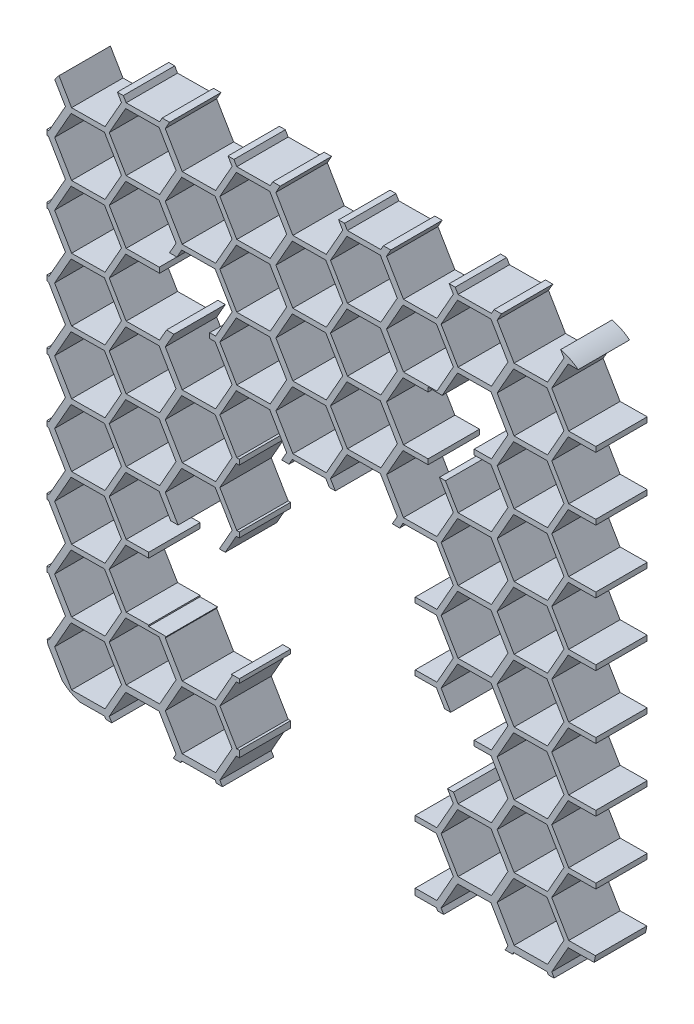
from build123d import *

# Parameters (mm, degrees)
BOSS_EXTRUDE1_DEPTH = 10
CUT_EXTRUDE3_REACH  = 78.178
SKETCH6_W           = 9.812922969
SKETCH6_H           = 13.289469161
SKETCH6_W_2         = 8.963334149
SKETCH6_H_2         = 14.059615098


with BuildPart() as part:
    # Sketch5 → Boss-Extrude1 (new body)
    with BuildSketch(Plane.XY):
        with BuildLine():
            Line((48.024312929, 39.190711098), (53.4, 39.238155691))
            Line((53.4, 39.238155691), (53.4, 40.238948483))
            Line((53.4, 40.238948483), (48.123676395, 40.192380849))
            Line((48.123676395, 40.192380849), (44.823994662, 45.792862211))
            Line((44.823994662, 45.792862211), (48.024312929, 51.450711098))
            Line((48.024312929, 51.450711098), (49.971786332, 51.467899056))
            ThreePointArc((49.971786332, 51.467899056), (48.354295075, 52.484772753), (46.558601308, 53.137301665))
            Line((46.558601308, 53.137301665), (47.206523211, 52.037597259))
            Line((47.206523211, 52.037597259), (44.006204944, 46.379748373))
            Line((44.006204944, 46.379748373), (37.506204944, 46.322380849))
            Line((37.506204944, 46.322380849), (34.206523211, 51.922862211))
            Line((34.206523211, 51.922862211), (35.042054725, 53.4))
            Line((35.042054725, 53.4), (33.607240311, 53.4))
            Line((33.607240311, 53.4), (33.103676395, 52.509748373))
            Line((33.103676395, 52.509748373), (26.603676395, 52.452380849))
            Line((26.603676395, 52.452380849), (26.045359814, 53.4))
            Line((26.045359814, 53.4), (24.883825167, 53.4))
            Line((24.883825167, 53.4), (25.686523211, 52.037597259))
            Line((25.686523211, 52.037597259), (22.486204944, 46.379748373))
            Line((22.486204944, 46.379748373), (15.986204944, 46.322380849))
            Line((15.986204944, 46.322380849), (12.686523211, 51.922862211))
            Line((12.686523211, 51.922862211), (13.522054726, 53.4))
            Line((13.522054726, 53.4), (12.087240312, 53.4))
            Line((12.087240312, 53.4), (11.583676395, 52.509748373))
            Line((11.583676395, 52.509748373), (5.083676395, 52.452380849))
            Line((5.083676395, 52.452380849), (4.525359815, 53.4))
            Line((4.525359815, 53.4), (3.363825167, 53.4))
            Line((3.363825167, 53.4), (4.166523212, 52.037597259))
            Line((4.166523212, 52.037597259), (0.966204945, 46.379748373))
            Line((0.966204945, 46.379748373), (-5.533795055, 46.322380849))
            Line((-5.533795055, 46.322380849), (-8.833476788, 51.922862211))
            Line((-8.833476788, 51.922862211), (-7.997945274, 53.4))
            Line((-7.997945274, 53.4), (-9.432759688, 53.4))
            Line((-9.432759688, 53.4), (-9.936323605, 52.509748373))
            Line((-9.936323605, 52.509748373), (-16.436323605, 52.452380849))
            Line((-16.436323605, 52.452380849), (-16.994640185, 53.4))
            Line((-16.994640185, 53.4), (-18.156174833, 53.4))
            Line((-18.156174833, 53.4), (-17.353476788, 52.037597259))
            Line((-17.353476788, 52.037597259), (-20.553795055, 46.379748373))
            Line((-20.553795055, 46.379748373), (-27.053795055, 46.322380849))
            Line((-27.053795055, 46.322380849), (-30.353476788, 51.922862211))
            Line((-30.353476788, 51.922862211), (-29.517945274, 53.4))
            Line((-29.517945274, 53.4), (-30.952759688, 53.4))
            Line((-30.952759688, 53.4), (-31.456323605, 52.509748373))
            Line((-31.456323605, 52.509748373), (-37.956323605, 52.452380849))
            Line((-37.956323605, 52.452380849), (-38.514640185, 53.4))
            Line((-38.514640185, 53.4), (-39.676174832, 53.4))
            Line((-39.676174832, 53.4), (-38.873476788, 52.037597259))
            Line((-38.873476788, 52.037597259), (-42.073795055, 46.379748373))
            Line((-42.073795055, 46.379748373), (-48.573795055, 46.322380849))
            Line((-48.573795055, 46.322380849), (-51.028226224, 50.488235962))
            ThreePointArc((-51.028226224, 50.488235962), (-51.462039029, 49.979211839), (-51.856853764, 49.439378131))
            Line((-51.856853764, 49.439378131), (-49.776005337, 45.907597259))
            Line((-49.776005337, 45.907597259), (-52.976323604, 40.249748373))
            Line((-52.976323604, 40.249748373), (-53.4, 40.246009101))
            Line((-53.4, 40.246009101), (-53.4, 39.24521631))
            Line((-53.4, 39.24521631), (-53.07568707, 39.248078622))
            Line((-53.07568707, 39.248078622), (-49.776005337, 33.647597259))
            Line((-49.776005337, 33.647597259), (-52.976323604, 27.989748373))
            Line((-52.976323604, 27.989748373), (-53.4, 27.986009101))
            Line((-53.4, 27.986009101), (-53.4, 26.98521631))
            Line((-53.4, 26.98521631), (-53.07568707, 26.988078622))
            Line((-53.07568707, 26.988078622), (-49.776005337, 21.387597259))
            Line((-49.776005337, 21.387597259), (-52.976323604, 15.729748373))
            Line((-52.976323604, 15.729748373), (-53.4, 15.726009101))
            Line((-53.4, 15.726009101), (-53.4, 14.72521631))
            Line((-53.4, 14.72521631), (-53.07568707, 14.728078622))
            Line((-53.07568707, 14.728078622), (-49.776005337, 9.127597259))
            Line((-49.776005337, 9.127597259), (-52.976323604, 3.469748373))
            Line((-52.976323604, 3.469748373), (-53.4, 3.466009101))
            Line((-53.4, 3.466009101), (-53.4, 2.46521631))
            Line((-53.4, 2.46521631), (-53.07568707, 2.468078622))
            Line((-53.07568707, 2.468078622), (-49.776005337, -3.132402741))
            Line((-49.776005337, -3.132402741), (-52.976323604, -8.790251627))
            Line((-52.976323604, -8.790251627), (-53.4, -8.793990899))
            Line((-53.4, -8.793990899), (-53.4, -9.79478369))
            Line((-53.4, -9.79478369), (-53.07568707, -9.791921378))
            Line((-53.07568707, -9.791921378), (-49.776005337, -15.392402741))
            Line((-49.776005337, -15.392402741), (-52.976323604, -21.050251627))
            Line((-52.976323604, -21.050251627), (-53.4, -21.053990899))
            Line((-53.4, -21.053990899), (-53.4, -22.05478369))
            Line((-53.4, -22.05478369), (-53.07568707, -22.051921378))
            Line((-53.07568707, -22.051921378), (-49.776005337, -27.652402741))
            Line((-49.776005337, -27.652402741), (-52.976323604, -33.310251627))
            Line((-52.976323604, -33.310251627), (-53.4, -33.313990899))
            Line((-53.4, -33.313990899), (-53.4, -34.31478369))
            Line((-53.4, -34.31478369), (-53.07568707, -34.311921378))
            Line((-53.07568707, -34.311921378), (-49.776005337, -39.912402741))
            Line((-49.776005337, -39.912402741), (-52.976323604, -45.570251627))
            Line((-52.976323604, -45.570251627), (-53.323190943, -45.573313))
            ThreePointArc((-53.323190943, -45.573313), (-53.242654146, -46.075549953), (-53.13387237, -46.572434908))
            Line((-53.13387237, -46.572434908), (-53.07568707, -46.571921378))
            Line((-53.07568707, -46.571921378), (-50.40636612, -51.10250446))
            ThreePointArc((-50.40636612, -51.10250446), (-48.82537198, -52.236841381), (-47.037518323, -53.004853113))
            Line((-47.037518323, -53.004853113), (-42.173158521, -52.961921378))
            Line((-42.173158521, -52.961921378), (-41.915052131, -53.4))
            Line((-41.915052131, -53.4), (-40.753517484, -53.4))
            Line((-40.753517484, -53.4), (-41.256005338, -52.547137788))
            Line((-41.256005338, -52.547137788), (-38.055687071, -46.889288902))
            Line((-38.055687071, -46.889288902), (-31.555687071, -46.831921378))
            Line((-31.555687071, -46.831921378), (-28.256005338, -52.432402741))
            Line((-28.256005338, -52.432402741), (-28.80331921, -53.4))
            Line((-28.80331921, -53.4), (-27.368504796, -53.4))
            Line((-27.368504796, -53.4), (-27.153158521, -53.019288902))
            Line((-27.153158521, -53.019288902), (-20.653158521, -52.961921378))
            Line((-20.653158521, -52.961921378), (-20.395052131, -53.4))
            Line((-20.395052131, -53.4), (-19.233517484, -53.4))
            Line((-19.233517484, -53.4), (-19.736005338, -52.547137788))
            Line((-19.736005338, -52.547137788), (-16.535687071, -46.889288902))
            Line((-16.535687071, -46.889288902), (-10.035687071, -46.831921378))
            Line((-10.035687071, -46.831921378), (-6.736005338, -52.432402741))
            Line((-6.736005338, -52.432402741), (-7.28331921, -53.4))
            Line((-7.28331921, -53.4), (-5.848504796, -53.4))
            Line((-5.848504796, -53.4), (-5.633158521, -53.019288902))
            Line((-5.633158521, -53.019288902), (0.866841479, -52.961921378))
            Line((0.866841479, -52.961921378), (1.124947869, -53.4))
            Line((1.124947869, -53.4), (2.286482516, -53.4))
            Line((2.286482516, -53.4), (1.783994662, -52.547137788))
            Line((1.783994662, -52.547137788), (4.984312929, -46.889288902))
            Line((4.984312929, -46.889288902), (11.484312929, -46.831921378))
            Line((11.484312929, -46.831921378), (14.783994662, -52.432402741))
            Line((14.783994662, -52.432402741), (14.23668079, -53.4))
            Line((14.23668079, -53.4), (15.671495204, -53.4))
            Line((15.671495204, -53.4), (15.886841478, -53.019288902))
            Line((15.886841478, -53.019288902), (22.386841478, -52.961921378))
            Line((22.386841478, -52.961921378), (22.644947868, -53.4))
            Line((22.644947868, -53.4), (23.806482516, -53.4))
            Line((23.806482516, -53.4), (23.303994662, -52.547137788))
            Line((23.303994662, -52.547137788), (26.504312929, -46.889288902))
            Line((26.504312929, -46.889288902), (33.004312929, -46.831921378))
            Line((33.004312929, -46.831921378), (36.303994662, -52.432402741))
            Line((36.303994662, -52.432402741), (35.756680789, -53.4))
            Line((35.756680789, -53.4), (37.191495203, -53.4))
            Line((37.191495203, -53.4), (37.406841478, -53.019288902))
            Line((37.406841478, -53.019288902), (43.906841478, -52.961921378))
            Line((43.906841478, -52.961921378), (44.164947868, -53.4))
            Line((44.164947868, -53.4), (44.4, -53.4))
            ThreePointArc((44.4, -53.4), (44.850518956, -53.388716965), (45.299908308, -53.354896149))
            Line((45.299908308, -53.354896149), (44.823994662, -52.547137788))
            Line((44.823994662, -52.547137788), (48.024312929, -46.889288902))
            Line((48.024312929, -46.889288902), (53.061570316, -46.844831212))
            ThreePointArc((53.061570316, -46.844831212), (53.21447846, -46.217957502), (53.322078928, -45.581739231))
            Line((53.322078928, -45.581739231), (48.123676395, -45.627619151))
            Line((48.123676395, -45.627619151), (44.823994662, -40.027137788))
            Line((44.823994662, -40.027137788), (48.024312929, -34.369288902))
            Line((48.024312929, -34.369288902), (53.4, -34.321844309))
            Line((53.4, -34.321844309), (53.4, -33.321051517))
            Line((53.4, -33.321051517), (48.123676395, -33.367619151))
            Line((48.123676395, -33.367619151), (44.823994662, -27.767137788))
            Line((44.823994662, -27.767137788), (48.024312929, -22.109288902))
            Line((48.024312929, -22.109288902), (53.4, -22.061844309))
            Line((53.4, -22.061844309), (53.4, -21.061051517))
            Line((53.4, -21.061051517), (48.123676395, -21.107619151))
            Line((48.123676395, -21.107619151), (44.823994662, -15.507137788))
            Line((44.823994662, -15.507137788), (48.024312929, -9.849288902))
            Line((48.024312929, -9.849288902), (53.4, -9.801844309))
            Line((53.4, -9.801844309), (53.4, -8.801051517))
            Line((53.4, -8.801051517), (48.123676395, -8.847619151))
            Line((48.123676395, -8.847619151), (44.823994662, -3.247137788))
            Line((44.823994662, -3.247137788), (48.024312929, 2.410711098))
            Line((48.024312929, 2.410711098), (53.4, 2.458155691))
            Line((53.4, 2.458155691), (53.4, 3.458948483))
            Line((53.4, 3.458948483), (48.123676395, 3.412380849))
            Line((48.123676395, 3.412380849), (44.823994662, 9.012862212))
            Line((44.823994662, 9.012862212), (48.024312929, 14.670711098))
            Line((48.024312929, 14.670711098), (53.4, 14.718155691))
            Line((53.4, 14.718155691), (53.4, 15.718948483))
            Line((53.4, 15.718948483), (48.123676395, 15.672380849))
            Line((48.123676395, 15.672380849), (44.823994662, 21.272862212))
            Line((44.823994662, 21.272862212), (48.024312929, 26.930711098))
            Line((48.024312929, 26.930711098), (53.4, 26.978155691))
            Line((53.4, 26.978155691), (53.4, 27.978948483))
            Line((53.4, 27.978948483), (48.123676395, 27.932380849))
            Line((48.123676395, 27.932380849), (44.823994662, 33.532862212))
            Line((44.823994662, 33.532862212), (48.024312929, 39.190711098))
        make_face()
        Polygon((-42.173158521, -40.441921378), (-38.873476788, -46.042402741), (-42.073795055, -51.700251627), (-48.573795055, -51.757619151), (-51.873476788, -46.157137788), (-48.673158521, -40.499288902), align=None, mode=Mode.SUBTRACT)
        Polygon((-42.173158521, -28.181921378), (-38.873476788, -33.782402741), (-42.073795055, -39.440251627), (-48.573795055, -39.497619151), (-51.873476788, -33.897137788), (-48.673158521, -28.239288902), align=None, mode=Mode.SUBTRACT)
        Polygon((-31.555687071, -34.311921378), (-28.256005338, -39.912402741), (-31.456323605, -45.570251627), (-37.956323605, -45.627619151), (-41.256005338, -40.027137788), (-38.055687071, -34.369288902), align=None, mode=Mode.SUBTRACT)
        Polygon((-20.653158521, -40.441921378), (-17.353476788, -46.042402741), (-20.553795055, -51.700251627), (-27.053795055, -51.757619151), (-30.353476788, -46.157137788), (-27.153158521, -40.499288902), align=None, mode=Mode.SUBTRACT)
        Polygon((-20.653158521, -28.181921378), (-17.353476788, -33.782402741), (-20.553795055, -39.440251627), (-27.053795055, -39.497619151), (-30.353476788, -33.897137788), (-27.153158521, -28.239288902), align=None, mode=Mode.SUBTRACT)
        Polygon((-10.035687071, -34.311921378), (-6.736005338, -39.912402741), (-9.936323605, -45.570251627), (-16.436323605, -45.627619151), (-19.736005338, -40.027137788), (-16.535687071, -34.369288902), align=None, mode=Mode.SUBTRACT)
        Polygon((-42.173158521, -15.921921378), (-38.873476788, -21.522402741), (-42.073795055, -27.180251627), (-48.573795055, -27.237619151), (-51.873476788, -21.637137788), (-48.673158521, -15.979288902), align=None, mode=Mode.SUBTRACT)
        Polygon((-42.173158521, -3.661921378), (-38.873476788, -9.262402741), (-42.073795055, -14.920251627), (-48.573795055, -14.977619151), (-51.873476788, -9.377137788), (-48.673158521, -3.719288902), align=None, mode=Mode.SUBTRACT)
        Polygon((-31.555687071, -22.051921378), (-28.256005338, -27.652402741), (-31.456323605, -33.310251627), (-37.956323605, -33.367619151), (-41.256005338, -27.767137788), (-38.055687071, -22.109288902), align=None, mode=Mode.SUBTRACT)
        Polygon((-10.035687071, -22.051921378), (-6.736005338, -27.652402741), (-9.936323605, -33.310251627), (-16.436323605, -33.367619151), (-19.736005338, -27.767137788), (-16.535687071, -22.109288902), align=None, mode=Mode.SUBTRACT)
        Polygon((-20.653158521, -15.921921378), (-17.353476788, -21.522402741), (-20.553795055, -27.180251627), (-27.053795055, -27.237619151), (-30.353476788, -21.637137788), (-27.153158521, -15.979288902), align=None, mode=Mode.SUBTRACT)
        Polygon((-31.555687071, -9.791921378), (-28.256005338, -15.392402741), (-31.456323605, -21.050251627), (-37.956323605, -21.107619151), (-41.256005338, -15.507137788), (-38.055687071, -9.849288902), align=None, mode=Mode.SUBTRACT)
        Polygon((-31.555687071, 2.468078622), (-28.256005338, -3.132402741), (-31.456323605, -8.790251627), (-37.956323605, -8.847619151), (-41.256005338, -3.247137788), (-38.055687071, 2.410711098), align=None, mode=Mode.SUBTRACT)
        Polygon((-20.653158521, -3.661921378), (-17.353476788, -9.262402741), (-20.553795055, -14.920251627), (-27.053795055, -14.977619151), (-30.353476788, -9.377137788), (-27.153158521, -3.719288902), align=None, mode=Mode.SUBTRACT)
        Polygon((-10.035687071, -9.791921378), (-6.736005338, -15.392402741), (-9.936323605, -21.050251627), (-16.436323605, -21.107619151), (-19.736005338, -15.507137788), (-16.535687071, -9.849288902), align=None, mode=Mode.SUBTRACT)
        Polygon((-10.035687071, 2.468078622), (-6.736005338, -3.132402741), (-9.936323605, -8.790251627), (-16.436323605, -8.847619151), (-19.736005338, -3.247137788), (-16.535687071, 2.410711098), align=None, mode=Mode.SUBTRACT)
        Polygon((0.866841479, -40.441921378), (4.166523212, -46.042402741), (0.966204945, -51.700251627), (-5.533795055, -51.757619151), (-8.833476788, -46.157137788), (-5.633158521, -40.499288902), align=None, mode=Mode.SUBTRACT)
        Polygon((0.866841479, -28.181921378), (4.166523212, -33.782402741), (0.966204945, -39.440251627), (-5.533795055, -39.497619151), (-8.833476788, -33.897137788), (-5.633158521, -28.239288902), align=None, mode=Mode.SUBTRACT)
        Polygon((11.484312929, -34.311921378), (14.783994662, -39.912402741), (11.583676395, -45.570251627), (5.083676395, -45.627619151), (1.783994662, -40.027137788), (4.984312929, -34.369288902), align=None, mode=Mode.SUBTRACT)
        Polygon((22.386841478, -40.441921378), (25.686523211, -46.042402741), (22.486204944, -51.700251627), (15.986204944, -51.757619151), (12.686523211, -46.157137788), (15.886841478, -40.499288902), align=None, mode=Mode.SUBTRACT)
        Polygon((22.386841478, -28.181921378), (25.686523211, -33.782402741), (22.486204944, -39.440251627), (15.986204944, -39.497619151), (12.686523211, -33.897137788), (15.886841478, -28.239288902), align=None, mode=Mode.SUBTRACT)
        Polygon((43.906841478, -40.441921378), (47.206523211, -46.042402741), (44.006204944, -51.700251627), (37.506204944, -51.757619151), (34.206523211, -46.157137788), (37.406841478, -40.499288902), align=None, mode=Mode.SUBTRACT)
        Polygon((33.004312929, -34.311921378), (36.303994662, -39.912402741), (33.103676395, -45.570251627), (26.603676395, -45.627619151), (23.303994662, -40.027137788), (26.504312929, -34.369288902), align=None, mode=Mode.SUBTRACT)
        Polygon((43.906841478, -28.181921378), (47.206523211, -33.782402741), (44.006204944, -39.440251627), (37.506204944, -39.497619151), (34.206523211, -33.897137788), (37.406841478, -28.239288902), align=None, mode=Mode.SUBTRACT)
        Polygon((11.484312929, -22.051921378), (14.783994662, -27.652402741), (11.583676395, -33.310251627), (5.083676395, -33.367619151), (1.783994662, -27.767137788), (4.984312929, -22.109288902), align=None, mode=Mode.SUBTRACT)
        Polygon((0.866841479, -15.921921378), (4.166523212, -21.522402741), (0.966204945, -27.180251627), (-5.533795055, -27.237619151), (-8.833476788, -21.637137788), (-5.633158521, -15.979288902), align=None, mode=Mode.SUBTRACT)
        Polygon((22.386841478, -15.921921378), (25.686523211, -21.522402741), (22.486204944, -27.180251627), (15.986204944, -27.237619151), (12.686523211, -21.637137788), (15.886841478, -15.979288902), align=None, mode=Mode.SUBTRACT)
        Polygon((0.866841479, -3.661921378), (4.166523212, -9.262402741), (0.966204945, -14.920251627), (-5.533795055, -14.977619151), (-8.833476788, -9.377137788), (-5.633158521, -3.719288902), align=None, mode=Mode.SUBTRACT)
        Polygon((11.484312929, -9.791921378), (14.783994662, -15.392402741), (11.583676395, -21.050251627), (5.083676395, -21.107619151), (1.783994662, -15.507137788), (4.984312929, -9.849288902), align=None, mode=Mode.SUBTRACT)
        Polygon((11.484312929, 2.468078622), (14.783994662, -3.132402741), (11.583676395, -8.790251627), (5.083676395, -8.847619151), (1.783994662, -3.247137788), (4.984312929, 2.410711098), align=None, mode=Mode.SUBTRACT)
        Polygon((22.386841478, -3.661921378), (25.686523211, -9.262402741), (22.486204944, -14.920251627), (15.986204944, -14.977619151), (12.686523211, -9.377137788), (15.886841478, -3.719288902), align=None, mode=Mode.SUBTRACT)
        Polygon((33.004312929, -22.051921378), (36.303994662, -27.652402741), (33.103676395, -33.310251627), (26.603676395, -33.367619151), (23.303994662, -27.767137788), (26.504312929, -22.109288902), align=None, mode=Mode.SUBTRACT)
        Polygon((43.906841478, -15.921921378), (47.206523211, -21.522402741), (44.006204944, -27.180251627), (37.506204944, -27.237619151), (34.206523211, -21.637137788), (37.406841478, -15.979288902), align=None, mode=Mode.SUBTRACT)
        Polygon((33.004312929, -9.791921378), (36.303994662, -15.392402741), (33.103676395, -21.050251627), (26.603676395, -21.107619151), (23.303994662, -15.507137788), (26.504312929, -9.849288902), align=None, mode=Mode.SUBTRACT)
        Polygon((43.906841478, -3.661921378), (47.206523211, -9.262402741), (44.006204944, -14.920251627), (37.506204944, -14.977619151), (34.206523211, -9.377137788), (37.406841478, -3.719288902), align=None, mode=Mode.SUBTRACT)
        Polygon((33.004312929, 2.468078622), (36.303994662, -3.132402741), (33.103676395, -8.790251627), (26.603676395, -8.847619151), (23.303994662, -3.247137788), (26.504312929, 2.410711098), align=None, mode=Mode.SUBTRACT)
        Polygon((-42.173158521, 8.598078622), (-38.873476788, 2.997597259), (-42.073795055, -2.660251627), (-48.573795055, -2.717619151), (-51.873476788, 2.882862212), (-48.673158521, 8.540711098), align=None, mode=Mode.SUBTRACT)
        Polygon((-42.173158521, 20.858078622), (-38.873476788, 15.257597259), (-42.073795055, 9.599748373), (-48.573795055, 9.542380849), (-51.873476788, 15.142862212), (-48.673158521, 20.800711098), align=None, mode=Mode.SUBTRACT)
        Polygon((-42.173158521, 33.118078622), (-38.873476788, 27.517597259), (-42.073795055, 21.859748373), (-48.573795055, 21.802380849), (-51.873476788, 27.402862212), (-48.673158521, 33.060711098), align=None, mode=Mode.SUBTRACT)
        Polygon((-31.555687071, 14.728078622), (-28.256005338, 9.127597259), (-31.456323605, 3.469748373), (-37.956323605, 3.412380849), (-41.256005338, 9.012862212), (-38.055687071, 14.670711098), align=None, mode=Mode.SUBTRACT)
        Polygon((-20.653158521, 8.598078622), (-17.353476788, 2.997597259), (-20.553795055, -2.660251627), (-27.053795055, -2.717619151), (-30.353476788, 2.882862212), (-27.153158521, 8.540711098), align=None, mode=Mode.SUBTRACT)
        Polygon((-20.653158521, 20.858078622), (-17.353476788, 15.257597259), (-20.553795055, 9.599748373), (-27.053795055, 9.542380849), (-30.353476788, 15.142862212), (-27.153158521, 20.800711098), align=None, mode=Mode.SUBTRACT)
        Polygon((-10.035687071, 14.728078622), (-6.736005338, 9.127597259), (-9.936323605, 3.469748373), (-16.436323605, 3.412380849), (-19.736005338, 9.012862212), (-16.535687071, 14.670711098), align=None, mode=Mode.SUBTRACT)
        Polygon((-31.555687071, 26.988078622), (-28.256005338, 21.387597259), (-31.456323605, 15.729748373), (-37.956323605, 15.672380849), (-41.256005338, 21.272862212), (-38.055687071, 26.930711098), align=None, mode=Mode.SUBTRACT)
        Polygon((-10.035687071, 26.988078622), (-6.736005338, 21.387597259), (-9.936323605, 15.729748373), (-16.436323605, 15.672380849), (-19.736005338, 21.272862212), (-16.535687071, 26.930711098), align=None, mode=Mode.SUBTRACT)
        Polygon((-20.653158521, 33.118078622), (-17.353476788, 27.517597259), (-20.553795055, 21.859748373), (-27.053795055, 21.802380849), (-30.353476788, 27.402862212), (-27.153158521, 33.060711098), align=None, mode=Mode.SUBTRACT)
        Polygon((-42.173158521, 45.378078622), (-38.873476788, 39.777597259), (-42.073795055, 34.119748373), (-48.573795055, 34.062380849), (-51.873476788, 39.662862211), (-48.673158521, 45.320711098), align=None, mode=Mode.SUBTRACT)
        Polygon((-31.555687071, 39.248078622), (-28.256005338, 33.647597259), (-31.456323605, 27.989748373), (-37.956323605, 27.932380849), (-41.256005338, 33.532862212), (-38.055687071, 39.190711098), align=None, mode=Mode.SUBTRACT)
        Polygon((-31.555687071, 51.508078622), (-28.256005338, 45.907597259), (-31.456323605, 40.249748373), (-37.956323605, 40.192380849), (-41.256005338, 45.792862211), (-38.055687071, 51.450711098), align=None, mode=Mode.SUBTRACT)
        Polygon((-20.653158521, 45.378078622), (-17.353476788, 39.777597259), (-20.553795055, 34.119748373), (-27.053795055, 34.062380849), (-30.353476788, 39.662862211), (-27.153158521, 45.320711098), align=None, mode=Mode.SUBTRACT)
        Polygon((-10.035687071, 39.248078622), (-6.736005338, 33.647597259), (-9.936323605, 27.989748373), (-16.436323605, 27.932380849), (-19.736005338, 33.532862212), (-16.535687071, 39.190711098), align=None, mode=Mode.SUBTRACT)
        Polygon((-10.035687071, 51.508078622), (-6.736005338, 45.907597259), (-9.936323605, 40.249748373), (-16.436323605, 40.192380849), (-19.736005338, 45.792862211), (-16.535687071, 51.450711098), align=None, mode=Mode.SUBTRACT)
        Polygon((0.866841479, 8.598078622), (4.166523212, 2.997597259), (0.966204945, -2.660251627), (-5.533795055, -2.717619151), (-8.833476788, 2.882862212), (-5.633158521, 8.540711098), align=None, mode=Mode.SUBTRACT)
        Polygon((0.866841479, 20.858078622), (4.166523212, 15.257597259), (0.966204945, 9.599748373), (-5.533795055, 9.542380849), (-8.833476788, 15.142862212), (-5.633158521, 20.800711098), align=None, mode=Mode.SUBTRACT)
        Polygon((11.484312929, 14.728078622), (14.783994662, 9.127597259), (11.583676395, 3.469748373), (5.083676395, 3.412380849), (1.783994662, 9.012862212), (4.984312929, 14.670711098), align=None, mode=Mode.SUBTRACT)
        Polygon((22.386841478, 8.598078622), (25.686523211, 2.997597259), (22.486204944, -2.660251627), (15.986204944, -2.717619151), (12.686523211, 2.882862212), (15.886841478, 8.540711098), align=None, mode=Mode.SUBTRACT)
        Polygon((22.386841478, 20.858078622), (25.686523211, 15.257597259), (22.486204944, 9.599748373), (15.986204944, 9.542380849), (12.686523211, 15.142862212), (15.886841478, 20.800711098), align=None, mode=Mode.SUBTRACT)
        Polygon((11.484312929, 26.988078622), (14.783994662, 21.387597259), (11.583676395, 15.729748373), (5.083676395, 15.672380849), (1.783994662, 21.272862212), (4.984312929, 26.930711098), align=None, mode=Mode.SUBTRACT)
        Polygon((0.866841479, 33.118078622), (4.166523212, 27.517597259), (0.966204945, 21.859748373), (-5.533795055, 21.802380849), (-8.833476788, 27.402862212), (-5.633158521, 33.060711098), align=None, mode=Mode.SUBTRACT)
        Polygon((22.386841478, 33.118078622), (25.686523211, 27.517597259), (22.486204944, 21.859748373), (15.986204944, 21.802380849), (12.686523211, 27.402862212), (15.886841478, 33.060711098), align=None, mode=Mode.SUBTRACT)
        Polygon((43.906841478, 8.598078622), (47.206523211, 2.997597259), (44.006204944, -2.660251627), (37.506204944, -2.717619151), (34.206523211, 2.882862212), (37.406841478, 8.540711098), align=None, mode=Mode.SUBTRACT)
        Polygon((33.004312929, 14.728078622), (36.303994662, 9.127597259), (33.103676395, 3.469748373), (26.603676395, 3.412380849), (23.303994662, 9.012862212), (26.504312929, 14.670711098), align=None, mode=Mode.SUBTRACT)
        Polygon((43.906841478, 20.858078622), (47.206523211, 15.257597259), (44.006204944, 9.599748373), (37.506204944, 9.542380849), (34.206523211, 15.142862212), (37.406841478, 20.800711098), align=None, mode=Mode.SUBTRACT)
        Polygon((33.004312929, 26.988078622), (36.303994662, 21.387597259), (33.103676395, 15.729748373), (26.603676395, 15.672380849), (23.303994662, 21.272862212), (26.504312929, 26.930711098), align=None, mode=Mode.SUBTRACT)
        Polygon((43.906841478, 33.118078622), (47.206523211, 27.517597259), (44.006204944, 21.859748373), (37.506204944, 21.802380849), (34.206523211, 27.402862212), (37.406841478, 33.060711098), align=None, mode=Mode.SUBTRACT)
        Polygon((0.866841479, 45.378078622), (4.166523212, 39.777597259), (0.966204945, 34.119748373), (-5.533795055, 34.062380849), (-8.833476788, 39.662862211), (-5.633158521, 45.320711098), align=None, mode=Mode.SUBTRACT)
        Polygon((11.484312929, 39.248078622), (14.783994662, 33.647597259), (11.583676395, 27.989748373), (5.083676395, 27.932380849), (1.783994662, 33.532862212), (4.984312929, 39.190711098), align=None, mode=Mode.SUBTRACT)
        Polygon((11.484312929, 51.508078622), (14.783994662, 45.907597259), (11.583676395, 40.249748373), (5.083676395, 40.192380849), (1.783994662, 45.792862211), (4.984312929, 51.450711098), align=None, mode=Mode.SUBTRACT)
        Polygon((22.386841478, 45.378078622), (25.686523211, 39.777597259), (22.486204944, 34.119748373), (15.986204944, 34.062380849), (12.686523211, 39.662862211), (15.886841478, 45.320711098), align=None, mode=Mode.SUBTRACT)
        Polygon((33.004312929, 39.248078622), (36.303994662, 33.647597259), (33.103676395, 27.989748373), (26.603676395, 27.932380849), (23.303994662, 33.532862212), (26.504312929, 39.190711098), align=None, mode=Mode.SUBTRACT)
        Polygon((43.906841478, 45.378078622), (47.206523211, 39.777597259), (44.006204944, 34.119748373), (37.506204944, 34.062380849), (34.206523211, 39.662862211), (37.406841478, 45.320711098), align=None, mode=Mode.SUBTRACT)
        Polygon((33.004312929, 51.508078622), (36.303994662, 45.907597259), (33.103676395, 40.249748373), (26.603676395, 40.192380849), (23.303994662, 45.792862211), (26.504312929, 51.450711098), align=None, mode=Mode.SUBTRACT)
    extrude(amount=BOSS_EXTRUDE1_DEPTH)

    # Sketch6 → Cut-Extrude3 (cut, up to next)
    with BuildSketch(Plane.XY, mode=Mode.PRIVATE) as cut_extrude3_sk1:
        with Locations((-26.613029506, 24.758372115)):
            Rectangle(SKETCH6_W, SKETCH6_H)
    cut_extrude3_tool1 = extrude(cut_extrude3_sk1.sketch, amount=CUT_EXTRUDE3_REACH, mode=Mode.PRIVATE) & part.part
    # Sketch6 → Cut-Extrude3 (cut, up to next)
    with BuildSketch(Plane.XY, mode=Mode.PRIVATE) as cut_extrude3_sk2:
        Polygon((-15.956820411, -33.57525271), (-15.956820411, -61.63965304), (18.273133052, -61.63965304), (18.273133052, -31.837158124), (29.741111887, -31.837158124), (29.741111887, -18.666034054), (18.273133052, -18.666034054), (18.273133052, 7.412477374), (-15.956820411, 7.412477374), (-15.956820411, -13.627996823), (-33.57525271, -13.627996823), (-33.57525271, -33.57525271), align=None)
    cut_extrude3_tool2 = extrude(cut_extrude3_sk2.sketch, amount=CUT_EXTRUDE3_REACH, mode=Mode.PRIVATE) & part.part
    # Sketch6 → Cut-Extrude3 (cut, up to next)
    with BuildSketch(Plane.XY, mode=Mode.PRIVATE) as cut_extrude3_sk3:
        with Locations((25.259444812, 26.869729605)):
            Rectangle(SKETCH6_W_2, SKETCH6_H_2)
    cut_extrude3_tool3 = extrude(cut_extrude3_sk3.sketch, amount=CUT_EXTRUDE3_REACH, mode=Mode.PRIVATE) & part.part
    add(cut_extrude3_tool1.solids().sort_by_distance((-26.61303, 24.758372, 0))[0], mode=Mode.SUBTRACT)
    add(cut_extrude3_tool2.solids().sort_by_distance((-0.816465, -26.584831, 0))[0], mode=Mode.SUBTRACT)
    add(cut_extrude3_tool3.solids().sort_by_distance((25.259445, 26.86973, 0))[0], mode=Mode.SUBTRACT)


solid = part.part
